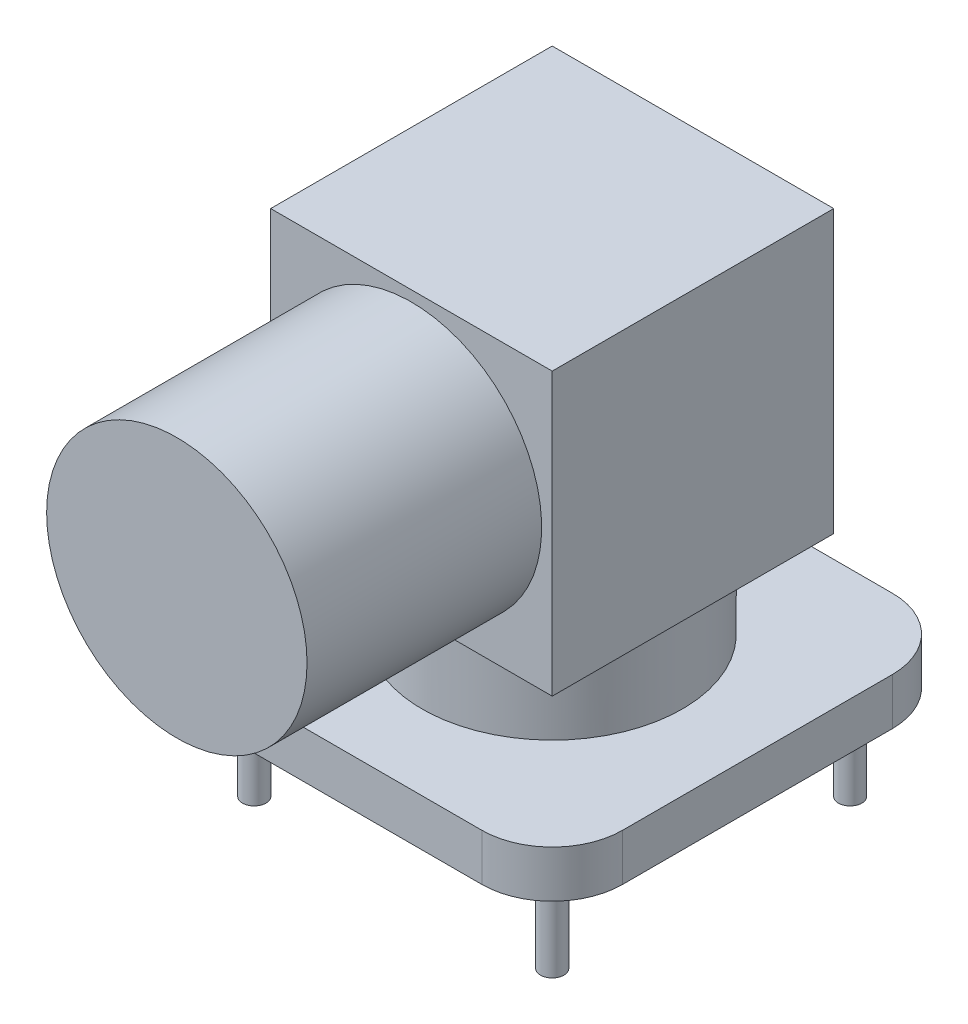
from build123d import *

# Parameters (mm, degrees)
AUFSATZ_LINEAR_AUSTRAGEN1_DEPTH = 2
SKIZZE2_R                       = 0.5
AUFSATZ_LINEAR_AUSTRAGEN2_DEPTH = 4
SKIZZE3_R                       = 5.55
AUFSATZ_LINEAR_AUSTRAGEN3_DEPTH = 3.7
SKIZZE4_W                       = 12
SKIZZE4_H                       = 12
AUFSATZ_LINEAR_AUSTRAGEN4_DEPTH = 12
SKIZZE5_R                       = 5.55
AUFSATZ_LINEAR_AUSTRAGEN5_DEPTH = 10


with BuildPart() as part:
    # Skizze1 → Aufsatz-Linear austragen1 (new body)
    with BuildSketch(Plane(origin=(0, 0, 0), x_dir=(1, 0, 0), z_dir=(0, 1, 0))):
        with BuildLine():
            Line((-5.75, -8.75), (5.75, -8.75))
            ThreePointArc((5.75, -8.75), (7.871320344, -7.871320344), (8.75, -5.75))
            Line((8.75, -5.75), (8.75, 5.75))
            ThreePointArc((8.75, 5.75), (7.871320344, 7.871320344), (5.75, 8.75))
            Line((5.75, 8.75), (-5.75, 8.75))
            ThreePointArc((-5.75, 8.75), (-7.871320344, 7.871320344), (-8.75, 5.75))
            Line((-8.75, 5.75), (-8.75, -5.75))
            ThreePointArc((-8.75, -5.75), (-7.871320344, -7.871320344), (-5.75, -8.75))
        make_face()
    extrude(amount=AUFSATZ_LINEAR_AUSTRAGEN1_DEPTH)

    # Skizze2 → Aufsatz-Linear austragen2 (add)
    with BuildSketch(Plane.XZ):
        with Locations((6.35, -6.35)):
            Circle(SKIZZE2_R)
        with Locations((-6.35, 6.35)):
            Circle(SKIZZE2_R)
        with Locations((6.35, 6.35)):
            Circle(SKIZZE2_R)
        with Locations((-6.35, -6.35)):
            Circle(SKIZZE2_R)
        Circle(SKIZZE2_R)
    extrude(amount=AUFSATZ_LINEAR_AUSTRAGEN2_DEPTH)

    # Skizze3 → Aufsatz-Linear austragen3 (add)
    with BuildSketch(Plane(origin=(0, 2, 0), x_dir=(1, 0, 0), z_dir=(0, 1, 0))):
        Circle(SKIZZE3_R)
    extrude(amount=AUFSATZ_LINEAR_AUSTRAGEN3_DEPTH)

    # Skizze4 → Aufsatz-Linear austragen4 (add)
    with BuildSketch(Plane(origin=(0, 5.7, 0), x_dir=(1, 0, 0), z_dir=(0, 1, 0))):
        Rectangle(SKIZZE4_W, SKIZZE4_H)
    extrude(amount=AUFSATZ_LINEAR_AUSTRAGEN4_DEPTH)

    # Skizze5 → Aufsatz-Linear austragen5 (add)
    with BuildSketch(Plane.XY.offset(6)):
        with Locations((0, 11.7)):
            Circle(SKIZZE5_R)
    extrude(amount=AUFSATZ_LINEAR_AUSTRAGEN5_DEPTH)


solid = part.part
